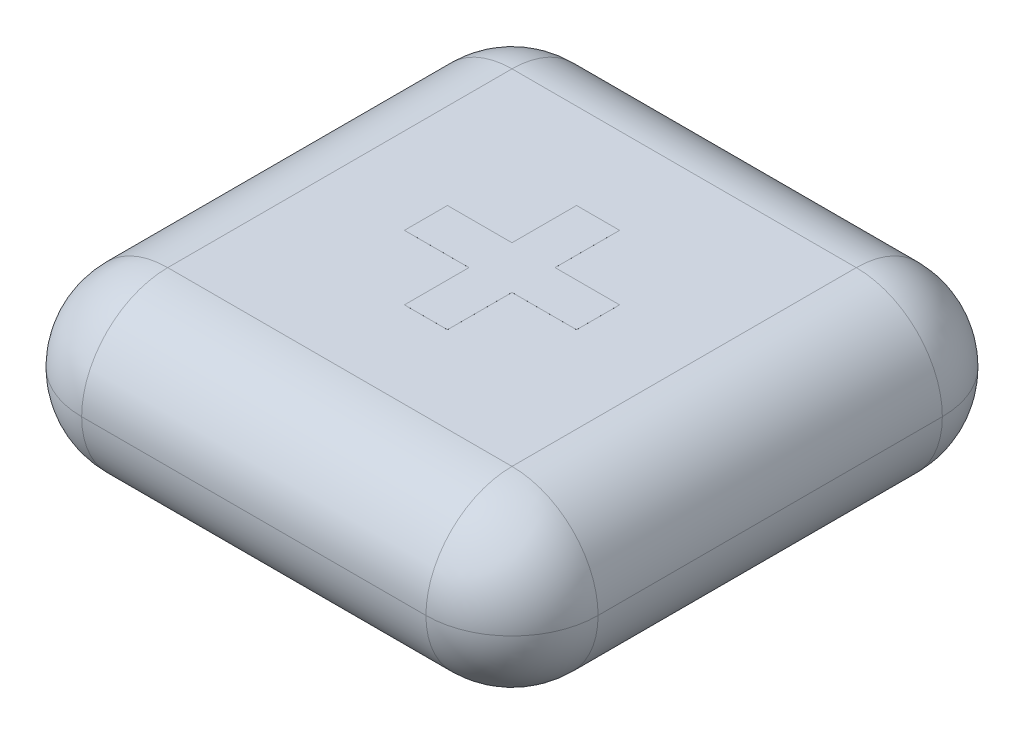
from build123d import *

# Parameters (mm, degrees)
SKETCH1_W           = 76.2
SKETCH1_H           = 76.2
BOSS_EXTRUDE1_DEPTH = 25.4
FILLET1_R           = 12.7
SKETCH2_W           = 6.35
SKETCH2_H           = 25.4
SKETCH2_W_2         = 25.4
SKETCH2_H_2         = 6.35
BOSS_EXTRUDE2_DEPTH = 0.00254


with BuildPart() as part:
    # Sketch1 → Boss-Extrude1 (new body)
    with BuildSketch(Plane(origin=(0, 0, 0), x_dir=(1, 0, 0), z_dir=(0, 1, 0))):
        Rectangle(SKETCH1_W, SKETCH1_H)
    extrude(amount=BOSS_EXTRUDE1_DEPTH)

    # Fillet1
    fillet1_edges = [part.edges().sort_by_distance(p)[0] for p in [
        (0, 25.4, 38.1),
        (-38.1, 25.4, 0),
        (0, 25.4, -38.1),
        (-38.1, 0, 0),
        (0, 0, 38.1),
        (38.1, 0, 0),
        (0, 0, -38.1),
        (-38.1, 12.7, -38.1),
        (-38.1, 12.7, 38.1),
        (38.1, 12.7, 38.1),
        (38.1, 12.7, -38.1),
        (38.1, 25.4, 0),
    ]]
    fillet(fillet1_edges, radius=FILLET1_R - 0.0001)  # a hair under: the kernel refuses the full size

    # Sketch2 → Boss-Extrude2 (add)
    with BuildSketch(Plane(origin=(0, 25.4, 0), x_dir=(1, 0, 0), z_dir=(0, 1, 0))):
        Rectangle(SKETCH2_W, SKETCH2_H)
        Rectangle(SKETCH2_W_2, SKETCH2_H_2)
    extrude(amount=BOSS_EXTRUDE2_DEPTH)


solid = part.part
